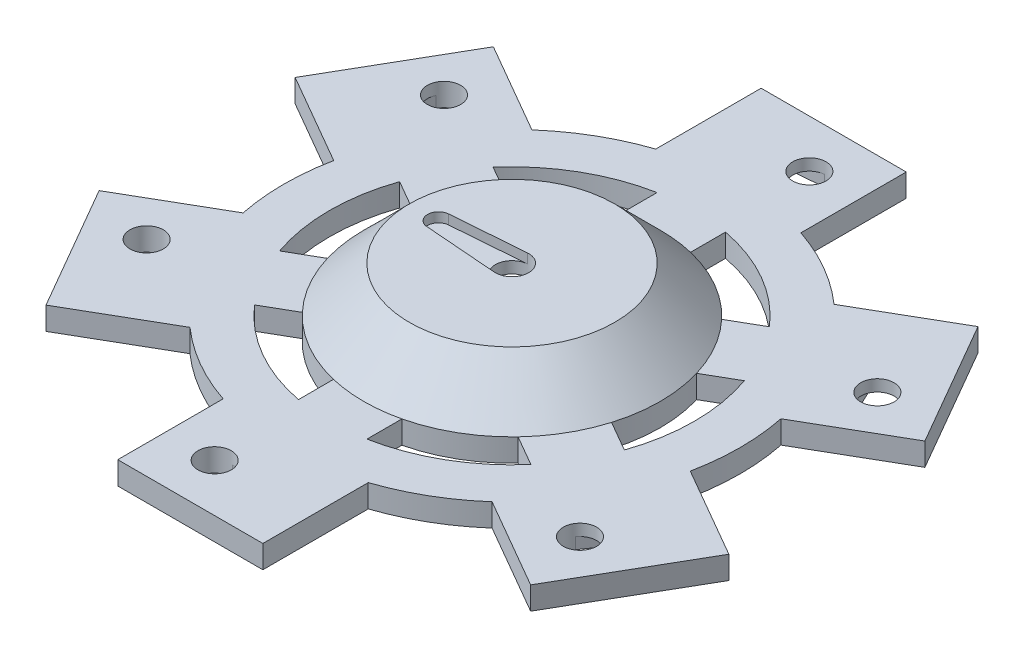
from build123d import *

# Parameters (mm, degrees)
BOSS_EXTRUDE1_DEPTH = 5
CIRPATTERN1_COUNT   = 3
CIRPATTERN1_ANGLE   = 120
SKETCH8_R           = 22.5
BOSS_EXTRUDE4_DEPTH = 10
SKETCH11_R          = 22.5
CUT_EXTRUDE4_DEPTH  = 11.7
SKETCH12_R          = 4
CUT_EXTRUDE5_DEPTH  = 3.3
SKETCH14_R          = 3.65
CUT_EXTRUDE7_DEPTH  = 100.784323589
CIRPATTERN2_COUNT   = 6
CUT_EXTRUDE9_DEPTH  = 15
SKETCH16_R          = 2.4
SKETCH16_R_2        = 3.65
CUT_EXTRUDE10_DEPTH = 2.46
CIRPATTERN3_COUNT   = 6
SKETCH17_R          = 4
SKETCH17_R_2        = 3.65
BOSS_EXTRUDE5_DEPTH = 3.3
CUT_EXTRUDE11_START = -2.1
SKETCH18_R          = 2.4
SKETCH18_R_2        = 3.65
CUT_EXTRUDE11_DEPTH = 2.1
BOSS_EXTRUDE6_START = 1.34
SKETCH21_R          = 22.5
BOSS_EXTRUDE6_DEPTH = 1.34
CUT_EXTRUDE12_START = -10.34
SKETCH22_R          = 3.65
CUT_EXTRUDE12_DEPTH = 10.34


# Read off the part's stored shape, not the designer's step: Boundary2
with BuildPart() as part:
    # Sketch1 → Boss-Extrude1 (new body)
    with BuildSketch(Plane(origin=(0, 0, 0), x_dir=(1, 0, 0), z_dir=(0, 1, 0))):
        with BuildLine():
            ThreePointArc((-15.9, 47.404535648), (-50, 0), (-15.9, -47.404535648))
            Line((-15.9, -47.404535648), (-15.9, 47.404535648))
        make_face()
        with BuildLine():
            ThreePointArc((-15.9, -47.404535648), (0, -50), (15.9, -47.404535648))
            Line((15.9, -47.404535648), (15.9, 47.404535648))
            ThreePointArc((15.9, 47.404535648), (0, 50), (-15.9, 47.404535648))
            Line((-15.9, 47.404535648), (-15.9, -47.404535648))
        make_face()
        with BuildLine():
            Line((-15.9, -70.5), (15.9, -70.5))
            Line((15.9, -70.5), (15.9, -47.404535648))
            ThreePointArc((15.9, -47.404535648), (0, -50), (-15.9, -47.404535648))
            Line((-15.9, -47.404535648), (-15.9, -70.5))
        make_face()
        with BuildLine():
            ThreePointArc((-15.9, 47.404535648), (0, 50), (15.9, 47.404535648))
            Line((15.9, 47.404535648), (15.9, 70.5))
            Line((15.9, 70.5), (-15.9, 70.5))
            Line((-15.9, 70.5), (-15.9, 47.404535648))
        make_face()
        with BuildLine():
            Line((15.9, 47.404535648), (15.9, -47.404535648))
            ThreePointArc((15.9, -47.404535648), (40.589407485, -29.197602641), (50, 0))
            ThreePointArc((50, 0), (40.589407485, 29.197602641), (15.9, 47.404535648))
        make_face()
    boss_extrude1 = extrude(amount=BOSS_EXTRUDE1_DEPTH)

    # CirPattern1: Boss-Extrude1 ×3 about axis
    cirpattern1_axis = Axis((0, 0, 0), (0, 1, 0))
    for i in range(1, CIRPATTERN1_COUNT):
        add(boss_extrude1.rotate(cirpattern1_axis, i * CIRPATTERN1_ANGLE / (CIRPATTERN1_COUNT - 1)))

    # Sketch8 → Boss-Extrude4 (add)
    with BuildSketch(Plane(origin=(0, 5, 0), x_dir=(1, 0, 0), z_dir=(0, 1, 0))):
        with Locations(Location((0, 0, 0), (0, 0, 270))):
            Circle(SKETCH8_R)
    extrude(amount=BOSS_EXTRUDE4_DEPTH)

    # Boundary2 outline → Boundary2 (revolve)
    with BuildSketch(Plane.XY):
        Polygon((32.5, 5), (22.499998072, 15.000001928), (22.5, 5), align=None)
    revolve(axis=Axis((0, 0, 0), (0, 1, 0)))

    # Sketch11 → Cut-Extrude4 (cut)
    with BuildSketch(Plane.XZ):
        with Locations(Location((0, 0, 0), (0, 0, 270))):
            Circle(SKETCH11_R)
    extrude(amount=-CUT_EXTRUDE4_DEPTH, mode=Mode.SUBTRACT)

    # Sketch12 → Cut-Extrude5 (cut)
    with BuildSketch(Plane.XZ.offset(-11.7)):
        with Locations(Location((0, 0, 0), (0, 0, 270))):
            Circle(SKETCH12_R)
    extrude(amount=-CUT_EXTRUDE5_DEPTH, mode=Mode.SUBTRACT)

    # Sketch14 → Cut-Extrude7 (cut, through all)
    with BuildSketch(Plane(origin=(0, 0, 0), x_dir=(-1, 0, 0), z_dir=(0, -1, 0))):
        with Locations(Location((5.17, -60, 0), (0, 0, 90))):
            Circle(SKETCH14_R)
    cut_extrude7 = extrude(amount=-CUT_EXTRUDE7_DEPTH, mode=Mode.SUBTRACT)

    # CirPattern2: Cut-Extrude7 ×6 about axis
    cirpattern2_axis = Axis((0, 0, 0), (0, 1, 0))
    for i in range(1, CIRPATTERN2_COUNT):
        add(cut_extrude7.rotate(cirpattern2_axis, i * 360 / CIRPATTERN2_COUNT), mode=Mode.SUBTRACT)

    # Sketch15 → Cut-Extrude9 (cut)
    with BuildSketch(Plane(origin=(0, 5, 0), x_dir=(1, 0, 0), z_dir=(0, 1, 0))):
        with BuildLine():
            Line((-37.776643972, 13.150101528), (-31.136127875, 9.316197772))
            ThreePointArc((-31.136127875, 9.316197772), (-32.5, 0), (-31.136127875, -9.316197772))
            Line((-31.136127875, -9.316197772), (-37.776643972, -13.150101528))
            ThreePointArc((-37.776643972, -13.150101528), (-40, 0), (-37.776643972, 13.150101528))
        make_face()
        with BuildLine():
            Line((-30.276643972, 26.140482585), (-23.636127875, 22.306578829))
            ThreePointArc((-23.636127875, 22.306578829), (-16.25, 28.145825623), (-7.5, 31.622776602))
            Line((-7.5, 31.622776602), (-7.5, 39.290584114))
            ThreePointArc((-7.5, 39.290584114), (-20, 34.641016151), (-30.276643972, 26.140482585))
        make_face()
        with BuildLine():
            Line((7.5, 39.290584114), (7.5, 31.622776602))
            ThreePointArc((7.5, 31.622776602), (16.25, 28.145825623), (23.636127875, 22.306578829))
            Line((23.636127875, 22.306578829), (30.276643972, 26.140482585))
            ThreePointArc((30.276643972, 26.140482585), (20, 34.641016151), (7.5, 39.290584114))
        make_face()
        with BuildLine():
            Line((37.776643972, 13.150101528), (31.136127875, 9.316197772))
            ThreePointArc((31.136127875, 9.316197772), (32.5, 0), (31.136127875, -9.316197772))
            Line((31.136127875, -9.316197772), (37.776643972, -13.150101528))
            ThreePointArc((37.776643972, -13.150101528), (40, 0), (37.776643972, 13.150101528))
        make_face()
        with BuildLine():
            Line((30.276643972, -26.140482585), (23.636127875, -22.306578829))
            ThreePointArc((23.636127875, -22.306578829), (16.25, -28.145825623), (7.5, -31.622776602))
            Line((7.5, -31.622776602), (7.5, -39.290584114))
            ThreePointArc((7.5, -39.290584114), (20, -34.641016151), (30.276643972, -26.140482585))
        make_face()
        with BuildLine():
            Line((-7.5, -39.290584114), (-7.5, -31.622776602))
            ThreePointArc((-7.5, -31.622776602), (-16.25, -28.145825623), (-23.636127875, -22.306578829))
            Line((-23.636127875, -22.306578829), (-30.276643972, -26.140482585))
            ThreePointArc((-30.276643972, -26.140482585), (-20, -34.641016151), (-7.5, -39.290584114))
        make_face()
    extrude(amount=-CUT_EXTRUDE9_DEPTH, mode=Mode.SUBTRACT)

    # Sketch16 → Cut-Extrude10 (cut)
    with BuildSketch(Plane.XZ):
        with Locations((-10.93, -60)):
            Circle(SKETCH16_R)
        with BuildLine():
            Line((4.886614907, -56.361017603), (-11.116335404, -57.607244451))
            ThreePointArc((-11.116335404, -57.607244451), (-9.300154144, -58.238295574), (-8.53, -60))
            ThreePointArc((-8.53, -60), (-9.300154144, -61.761704426), (-11.116335404, -62.392755549))
            Line((-11.116335404, -62.392755549), (4.886614907, -63.638982397))
            ThreePointArc((4.886614907, -63.638982397), (1.52, -60), (4.886614907, -56.361017603))
        make_face()
        with Locations(Location((5.17, -60, 0), (0, 0, 94.452911391))):
            Circle(SKETCH16_R_2)
    cut_extrude10 = extrude(amount=-CUT_EXTRUDE10_DEPTH, mode=Mode.SUBTRACT)

    # CirPattern3: Cut-Extrude10 ×6 about axis
    cirpattern3_axis = Axis((0, 0, 0), (0, 1, 0))
    for i in range(1, CIRPATTERN3_COUNT):
        add(cut_extrude10.rotate(cirpattern3_axis, i * 360 / CIRPATTERN3_COUNT), mode=Mode.SUBTRACT)

    # Sketch17 → Boss-Extrude5 (add)
    with BuildSketch(Plane.XZ.offset(-11.7)):
        Circle(SKETCH17_R)
        with Locations(Location((0, 0, 0), (0, 0, 270))):
            Circle(SKETCH17_R_2, mode=Mode.SUBTRACT)
    extrude(amount=-BOSS_EXTRUDE5_DEPTH)

    # Sketch18 → Cut-Extrude11 (cut)
    with BuildSketch(Plane(origin=(0, 15, 0), x_dir=(1, 0, 0), z_dir=(0, 1, 0)).offset(CUT_EXTRUDE11_START)):
        with BuildLine():
            Line((-16.286335404, -2.392755549), (-0.283385093, -3.638982397))
            ThreePointArc((-0.283385093, -3.638982397), (-3.65, 0), (-0.283385093, 3.638982397))
            Line((-0.283385093, 3.638982397), (-16.286335404, 2.392755549))
            ThreePointArc((-16.286335404, 2.392755549), (-14.470154144, 1.761704426), (-13.7, 0))
            ThreePointArc((-13.7, 0), (-14.470154144, -1.761704426), (-16.286335404, -2.392755549))
        make_face()
        with Locations((-16.1, 0)):
            Circle(SKETCH18_R)
        with Locations(Location((0, 0, 0), (0, 0, 90))):
            Circle(SKETCH18_R_2)
    extrude(amount=CUT_EXTRUDE11_DEPTH, mode=Mode.SUBTRACT)

    # Sketch21 → Boss-Extrude6 (add)
    with BuildSketch(Plane(origin=(0, 11.7, 0), x_dir=(-1, 0, 0), z_dir=(0, -1, 0)).offset(BOSS_EXTRUDE6_START)):
        with Locations(Location((0, 0, 0), (0, 0, 90))):
            Circle(SKETCH21_R)
    extrude(amount=-BOSS_EXTRUDE6_DEPTH)

    # Sketch22 → Cut-Extrude12 (cut)
    with BuildSketch(Plane(origin=(0, 15, 0), x_dir=(1, 0, 0), z_dir=(0, 1, 0)).offset(CUT_EXTRUDE12_START)):
        with Locations(Location((0, 0, 0), (0, 0, 90))):
            Circle(SKETCH22_R)
    extrude(amount=CUT_EXTRUDE12_DEPTH, mode=Mode.SUBTRACT)


solid = part.part
